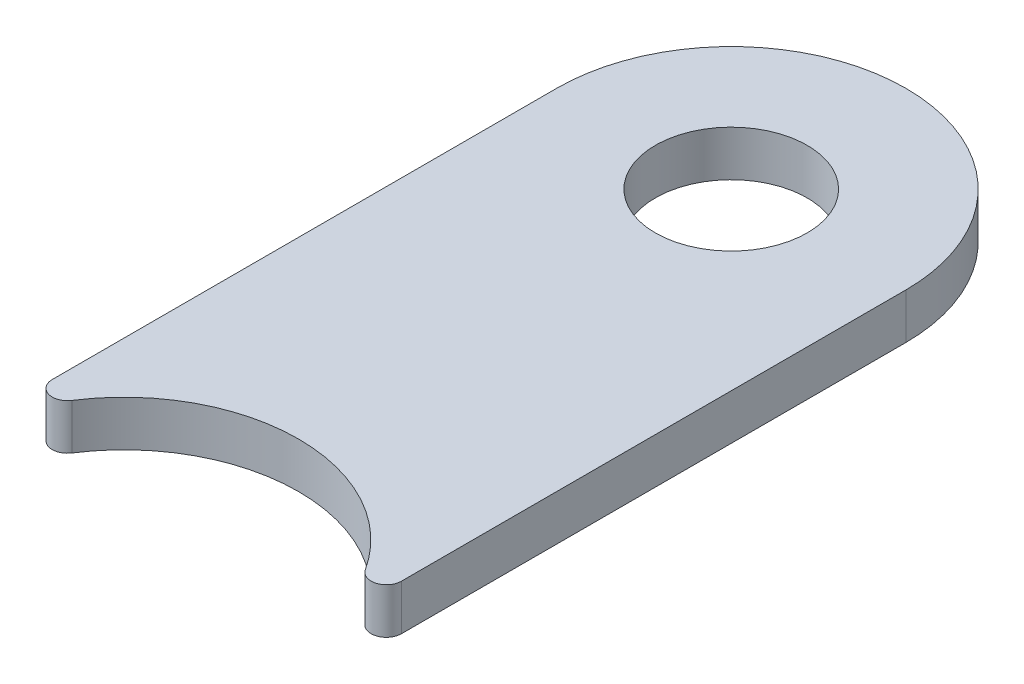
from build123d import *

# Parameters (mm, degrees)
SKETCH1_R           = 5
BOSS_EXTRUDE1_DEPTH = 3
FILLET1_R           = 1


with BuildPart() as part:
    # Sketch1 → Boss-Extrude1 (new body)
    with BuildSketch(Plane(origin=(0, 0, 0), x_dir=(1, 0, 0), z_dir=(0, 1, 0))):
        with BuildLine():
            Line((11.5, 0), (11.5, 40))
            ThreePointArc((11.5, 40), (0, 51.5), (-11.5, 40))
            Line((-11.5, 40), (-11.5, 0))
            ThreePointArc((-11.5, 0), (0, 11.5), (11.5, 0))
        make_face()
        with Locations((0, 40)):
            Circle(SKETCH1_R, mode=Mode.SUBTRACT)
    extrude(amount=BOSS_EXTRUDE1_DEPTH)

    # Fillet1
    fillet1_edges = [part.edges().sort_by_distance(p)[0] for p in [
        (-11.5, 1.5, 0),
        (11.5, 1.5, 0),
    ]]
    fillet(fillet1_edges, radius=FILLET1_R)


solid = part.part
